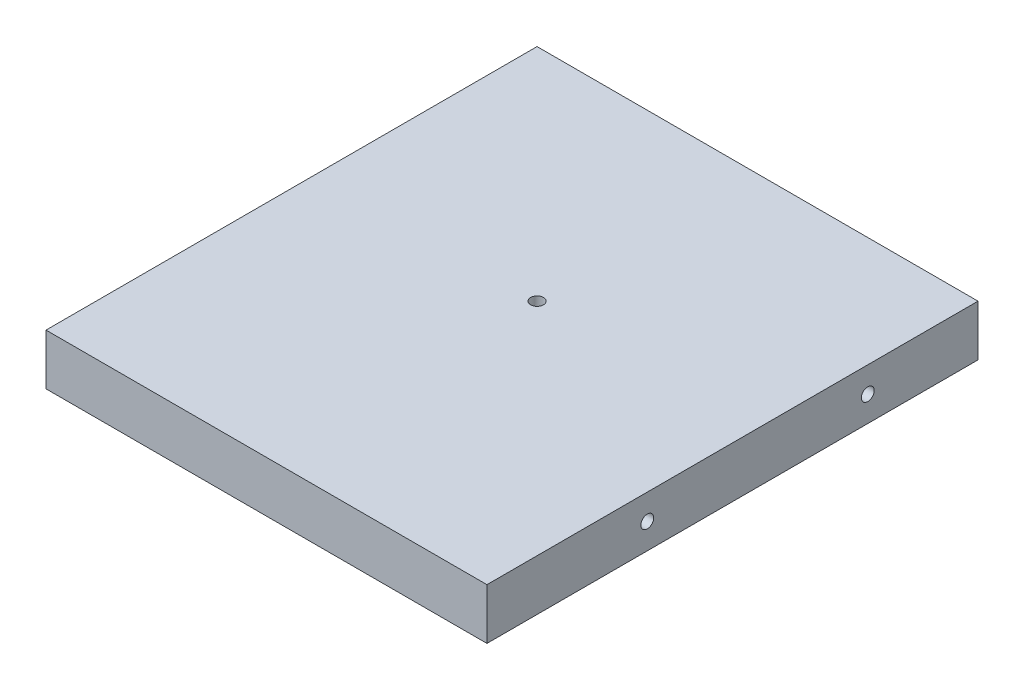
from build123d import *

# Parameters (mm, degrees)
SKETCH4_W           = 220
SKETCH4_H           = 220
BOSS_EXTRUDE2_DEPTH = 25.4
SKETCH5_R           = 3.2
CUT_EXTRUDE1_DEPTH  = 25.4
SKETCH7_R           = 3.2
CUT_EXTRUDE2_DEPTH  = 30
CUT_EXTRUDE4_START  = -30
SKETCH6_R           = 3.2
CUT_EXTRUDE4_DEPTH  = 30
SKETCH13_W          = 220
SKETCH13_H          = 25.4
BOSS_EXTRUDE3_DEPTH = 25


with BuildPart() as part:
    # Sketch4 → Boss-Extrude2 (new body)
    with BuildSketch(Plane(origin=(0, 0, 0), x_dir=(1, 0, 0), z_dir=(0, 1, 0))):
        with Locations((171.772904357, 21.481047821)):
            Rectangle(SKETCH4_W, SKETCH4_H)
    extrude(amount=BOSS_EXTRUDE2_DEPTH)

    # Sketch5 → Cut-Extrude1 (cut)
    with BuildSketch(Plane(origin=(0, 25.4, 0), x_dir=(1, 0, 0), z_dir=(0, 1, 0))):
        with Locations((171.772904357, 21.481047821)):
            Circle(SKETCH5_R)
    extrude(amount=-CUT_EXTRUDE1_DEPTH, mode=Mode.SUBTRACT)

    # Sketch7 → Cut-Extrude2 (cut)
    with BuildSketch(Plane.ZY.offset(-61.772904357)):
        with Locations((-76.481047821, 12.7)):
            Circle(SKETCH7_R)
        with Locations((33.518952179, 12.7)):
            Circle(SKETCH7_R)
    extrude(amount=-CUT_EXTRUDE2_DEPTH, mode=Mode.SUBTRACT)

    # Sketch6 → Cut-Extrude4 (cut)
    with BuildSketch(Plane(origin=(281.772904357, 0, 0), x_dir=(0, 0, -1), z_dir=(1, 0, 0)).offset(CUT_EXTRUDE4_START)):
        with Locations((-33.518952179, 12.7)):
            Circle(SKETCH6_R)
        with Locations((76.481047821, 12.7)):
            Circle(SKETCH6_R)
    extrude(amount=CUT_EXTRUDE4_DEPTH, mode=Mode.SUBTRACT)

    # Sketch13 → Boss-Extrude3 (add)
    with BuildSketch(Plane.XY.offset(88.518952179)):
        with Locations((171.772904357, 12.7)):
            Rectangle(SKETCH13_W, SKETCH13_H)
    extrude(amount=BOSS_EXTRUDE3_DEPTH)


solid = part.part
